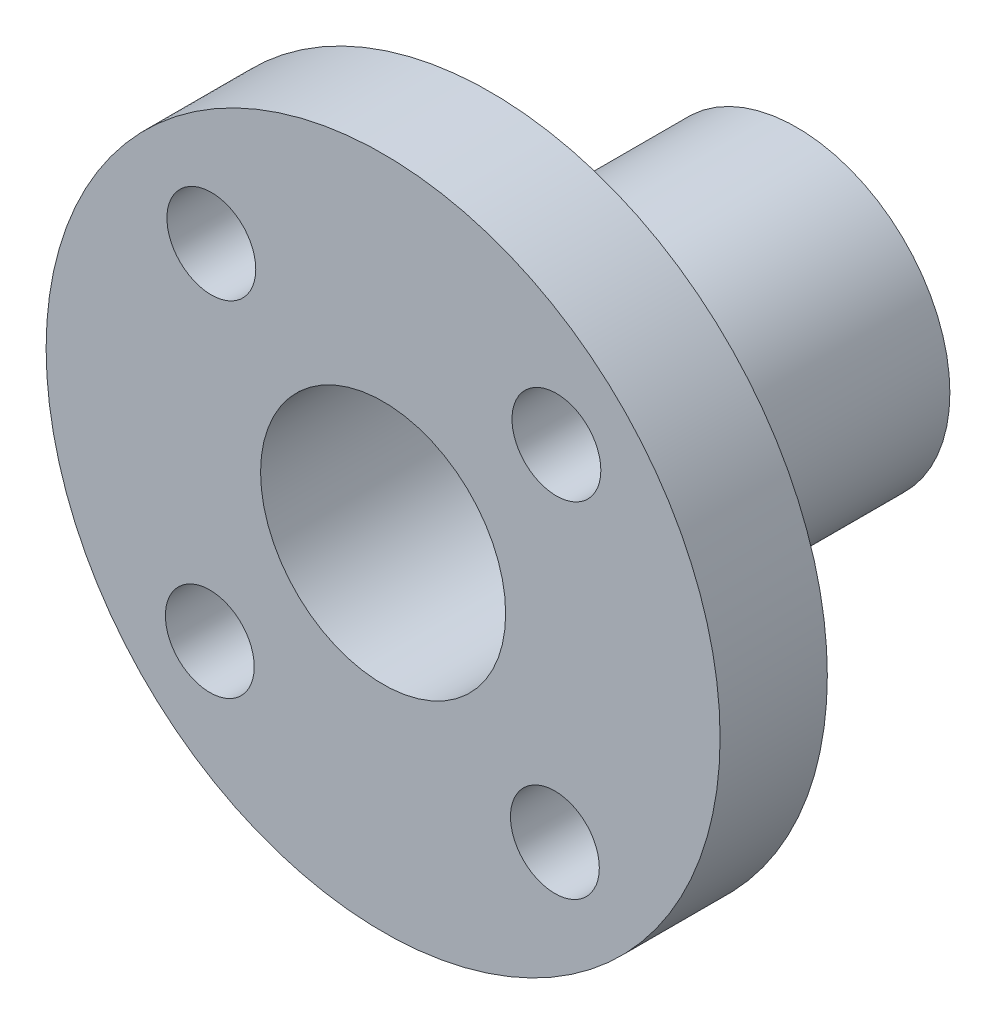
from build123d import *
from build123d.topology import SkipClean

# Parameters (mm, degrees)
SKETCH1_R           = 11
SKETCH1_R_2         = 1.45
SKETCH1_R_3         = 4
BOSS_EXTRUDE1_DEPTH = 3.5
BOSS_EXTRUDE2_START = 10
SKETCH2_R           = 5
SKETCH2_R_2         = 4
BOSS_EXTRUDE2_DEPTH = 10


with BuildPart() as part:
    # Sketch1 → Boss-Extrude1 (new body)
    with BuildSketch(Plane.XY):
        with Locations((0.049999962, 219.95)):
            Circle(SKETCH1_R)
        with Locations((-5.606854214, 214.343145734)):
            Circle(SKETCH1_R_2, mode=Mode.SUBTRACT)
        with Locations((5.656854228, 214.293145824)):
            Circle(SKETCH1_R_2, mode=Mode.SUBTRACT)
        with Locations((0.049999962, 219.95)):
            Circle(SKETCH1_R_3, mode=Mode.SUBTRACT)
        with Locations((-5.556854304, 225.606854176)):
            Circle(SKETCH1_R_2, mode=Mode.SUBTRACT)
        with Locations((5.706854138, 225.556854266)):
            Circle(SKETCH1_R_2, mode=Mode.SUBTRACT)
    extrude(amount=BOSS_EXTRUDE1_DEPTH)

    # Sketch2 → Boss-Extrude2 (add)
    with SkipClean():  # the faces are left unmerged after this step: merging them gives an invalid solid
        with BuildSketch(Plane(origin=(0, 0, 0), x_dir=(-1, 0, 0), z_dir=(0, 0, -1)).offset(BOSS_EXTRUDE2_START)):
            with Locations((-0.049999962, 219.95)):
                Circle(SKETCH2_R)
            with Locations((-0.049999962, 219.95)):
                Circle(SKETCH2_R_2, mode=Mode.SUBTRACT)
        extrude(amount=-BOSS_EXTRUDE2_DEPTH)


solid = part.part
